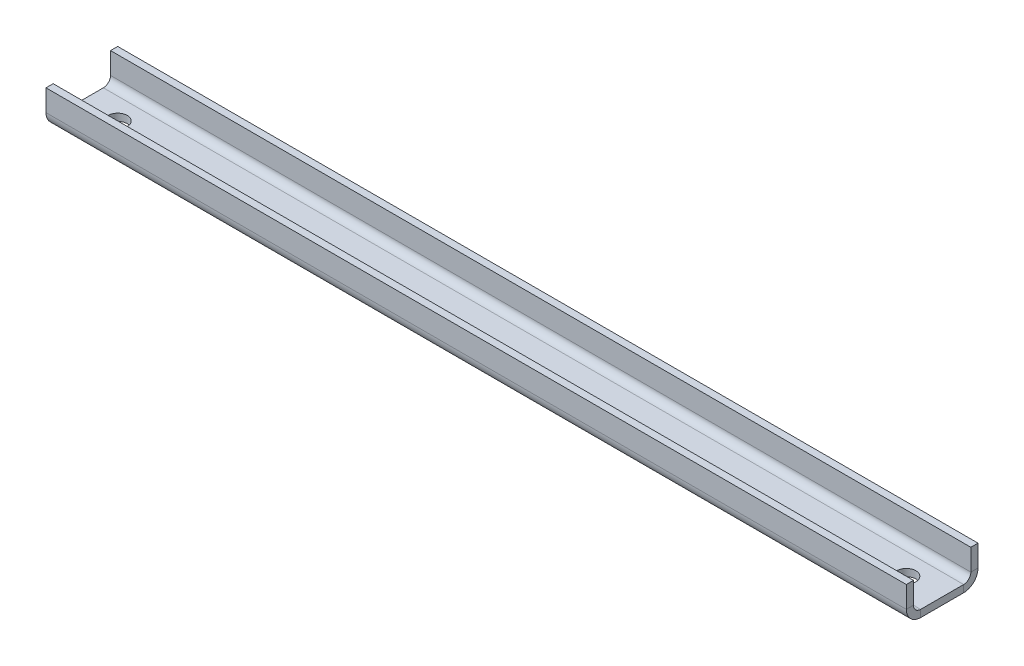
from build123d import *

# Parameters (mm, degrees)
ESQUISSE2_W                             = 360
ESQUISSE2_H                             = 30
T_LE_DE_BASE_PLI_E1_DEPTH               = 3
T_LE_PLI_E_SUR_AR_TE1_STRIP_W           = 18
T_LE_PLI_E_SUR_AR_TE1_STRIP_H           = 3
T_LE_PLI_E_SUR_AR_TE1_STRIP_CUT_DEPTH   = 360
T_LE_PLI_E_SUR_AR_TE1_STRIP_2_W         = 18
T_LE_PLI_E_SUR_AR_TE1_STRIP_2_H         = 3
T_LE_PLI_E_SUR_AR_TE1_STRIP_CUT_2_DEPTH = 360
T_LE_PLI_E_SUR_AR_TE1_DEPTH             = 360
T_LE_PLI_E_SUR_AR_TE1_BEND_DEPTH        = 360
ENL_V_MAT_EXTRU_1_REACH                 = 363.447
ESQUISSE10_R                            = 4


# Sheet-metal steps are written as plain solids
with BuildPart() as part:
    # Esquisse2 → Tôle de base pliée1 (new body)
    with BuildSketch(Plane(origin=(0, 0, 0), x_dir=(1, 0, 0), z_dir=(0, 1, 0))):
        with Locations((180, 15)):
            Rectangle(ESQUISSE2_W, ESQUISSE2_H)
    extrude(amount=-T_LE_DE_BASE_PLI_E1_DEPTH)

    # Tôle pliée sur arête1 strip (across the edge) → Tôle pliée sur arête1 strip cut (cut)
    with BuildSketch(Plane(origin=(0, 0, 0), x_dir=(0, 0, -1), z_dir=(1, 0, 0))):
        with Locations((-3, -1.5)):
            Rectangle(T_LE_PLI_E_SUR_AR_TE1_STRIP_W, T_LE_PLI_E_SUR_AR_TE1_STRIP_H)
    extrude(amount=T_LE_PLI_E_SUR_AR_TE1_STRIP_CUT_DEPTH, mode=Mode.SUBTRACT)

    # Tôle pliée sur arête1 strip 2 (across the edge) → Tôle pliée sur arête1 strip cut 2 (cut)
    with BuildSketch(Plane(origin=(360, 0, -30), x_dir=(0, 0, 1), z_dir=(-1, 0, 0))):
        with Locations((-3, -1.5)):
            Rectangle(T_LE_PLI_E_SUR_AR_TE1_STRIP_2_W, T_LE_PLI_E_SUR_AR_TE1_STRIP_2_H)
    extrude(amount=T_LE_PLI_E_SUR_AR_TE1_STRIP_CUT_2_DEPTH, mode=Mode.SUBTRACT)

    # Tôle pliée sur arête1 section (across the edge) → Tôle pliée sur arête1 (add)
    with BuildSketch(Plane(origin=(0, 0, 0), x_dir=(0, 0, -1), z_dir=(1, 0, 0))):
        with BuildLine():
            Line((0, 3), (0, 12))
            Line((0, 12), (3, 12))
            Line((3, 12), (3, 3))
            ThreePointArc((3, 3), (3.878679656, 0.878679656), (6, 0))
            Line((6, 0), (6, -3))
            ThreePointArc((6, -3), (1.757359313, -1.242640687), (0, 3))
        make_face()
    extrude(amount=T_LE_PLI_E_SUR_AR_TE1_DEPTH)

    # Tôle pliée sur arête1 section 2 (across the edge) → Tôle pliée sur arête1 bend (add)
    with BuildSketch(Plane(origin=(360, 0, -30), x_dir=(0, 0, 1), z_dir=(-1, 0, 0))):
        with BuildLine():
            Line((0, 3), (0, 12))
            Line((0, 12), (3, 12))
            Line((3, 12), (3, 3))
            ThreePointArc((3, 3), (3.878679656, 0.878679656), (6, 0))
            Line((6, 0), (6, -3))
            ThreePointArc((6, -3), (1.757359313, -1.242640687), (0, 3))
        make_face()
    extrude(amount=T_LE_PLI_E_SUR_AR_TE1_BEND_DEPTH)

    # Esquisse10 → Enlèv. mat.-Extru.1 (cut, up to next)
    with BuildSketch(Plane(origin=(0, 0, 0), x_dir=(1, 0, 0), z_dir=(0, 1, 0)), mode=Mode.PRIVATE) as enl_v_mat_extru_1_sk1:
        with Locations(Location((15, 15, 0), (0, 0, 270))):
            Circle(ESQUISSE10_R)
    enl_v_mat_extru_1_tool1 = extrude(enl_v_mat_extru_1_sk1.sketch, amount=-ENL_V_MAT_EXTRU_1_REACH, mode=Mode.PRIVATE) & part.part
    # Esquisse10 → Enlèv. mat.-Extru.1 (cut, up to next)
    with BuildSketch(Plane(origin=(0, 0, 0), x_dir=(1, 0, 0), z_dir=(0, 1, 0)), mode=Mode.PRIVATE) as enl_v_mat_extru_1_sk2:
        with Locations(Location((345, 15, 0), (0, 0, 270))):
            Circle(ESQUISSE10_R)
    enl_v_mat_extru_1_tool2 = extrude(enl_v_mat_extru_1_sk2.sketch, amount=-ENL_V_MAT_EXTRU_1_REACH, mode=Mode.PRIVATE) & part.part
    add(enl_v_mat_extru_1_tool1.solids().sort_by_distance((15, 0, -15))[0], mode=Mode.SUBTRACT)
    add(enl_v_mat_extru_1_tool2.solids().sort_by_distance((345, 0, -15))[0], mode=Mode.SUBTRACT)


solid = part.part
